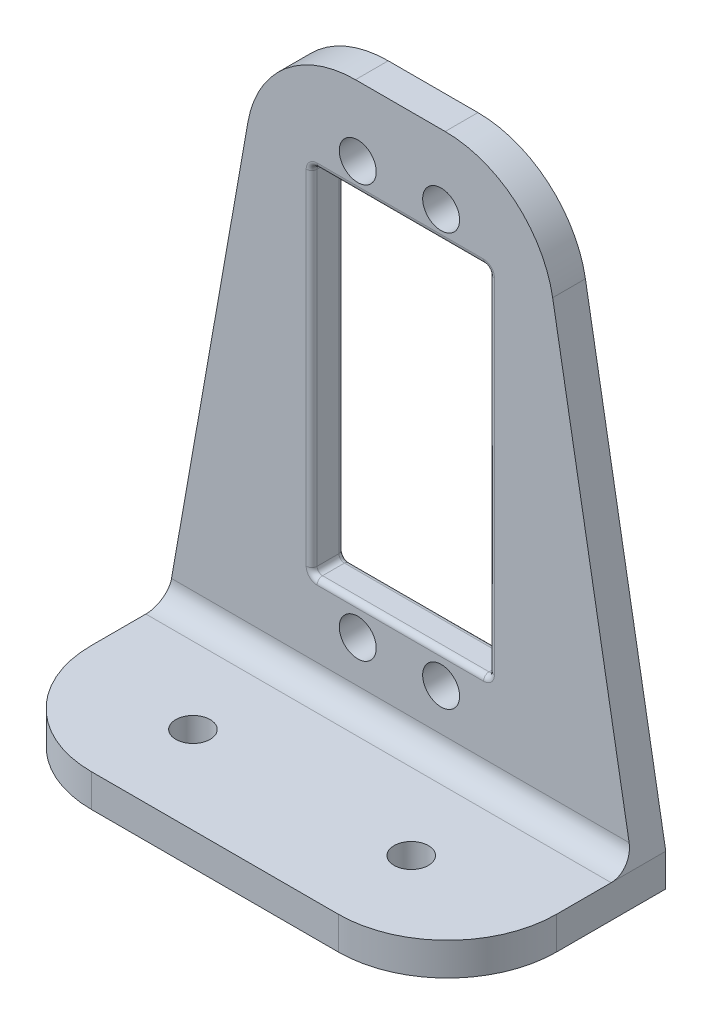
from build123d import *

# Parameters (mm, degrees)
FILLET2_START       = -0.929916211
FILLET2_OUTLINE_R   = 2.15
FILLET2_DEPTH       = 3.81
FILLET2_START_2     = 2.880083789
FILLET2_2_OUTLINE_W = 54.14352655
FILLET2_2_OUTLINE_H = 3.81
FILLET2_2_DEPTH     = 34.29
FILLET6_R           = 2.54
SKETCH6_W           = 54.14352655
SKETCH6_H           = 3.81
CUT_EXTRUDE2_DEPTH  = 12.7
FILLET8_R           = 12.7
SKETCH7_R           = 1.999996
CUT_EXTRUDE3_DEPTH  = 76.817206459
SKETCH8_W           = 20.6375
SKETCH8_H           = 41.275
CUT_EXTRUDE5_DEPTH  = 69.202637613
FILLET10_R          = 0.635


with BuildPart() as part:
    # Fillet2: read off the stored shape, not the designer's step
    # Fillet2 outline → Fillet2 (new body)
    with BuildSketch(Plane.XY.offset(FILLET2_START)):
        with BuildLine():
            Line((20.718778313, -51.581857548), (11.372508186, 1.423474309))
            ThreePointArc((11.372508186, 1.423474309), (7.028852365, 8.94690688), (-1.134550278, 11.918142452))
            Line((-1.134550278, 11.918142452), (-11.571419646, 11.918142452))
            ThreePointArc((-11.571419646, 11.918142452), (-19.734822289, 8.94690688), (-24.078478109, 1.423474309))
            Line((-24.078478109, 1.423474309), (-33.424748237, -51.581857548))
            Line((-33.424748237, -51.581857548), (-33.424748237, -55.391857548))
            Line((-33.424748237, -55.391857548), (20.718778313, -55.391857548))
            Line((20.718778313, -55.391857548), (20.718778313, -51.581857548))
        make_face()
        with Locations((-11.306344138, -44.161858203)):
            Circle(FILLET2_OUTLINE_R, mode=Mode.SUBTRACT)
        with Locations((-1.606344138, -44.161858203)):
            Circle(FILLET2_OUTLINE_R, mode=Mode.SUBTRACT)
        with Locations((-11.306344138, 3.838143108)):
            Circle(FILLET2_OUTLINE_R, mode=Mode.SUBTRACT)
        with Locations((-1.606344138, 3.838143108)):
            Circle(FILLET2_OUTLINE_R, mode=Mode.SUBTRACT)
    extrude(amount=FILLET2_DEPTH)

    # Fillet2 2 outline → Fillet2 2 (add)
    with BuildSketch(Plane.XY.offset(FILLET2_START_2)):
        with Locations((-6.352984962, -53.486857548)):
            Rectangle(FILLET2_2_OUTLINE_W, FILLET2_2_OUTLINE_H)
    extrude(amount=FILLET2_2_DEPTH)

    # Fillet6
    fillet6_edges = [part.edges().sort_by_distance(p)[0] for p in [
        (-6.352984962, -51.581857548, 2.880083789),
    ]]
    fillet(fillet6_edges, radius=FILLET6_R)

    # Sketch6 → Cut-Extrude2 (cut)
    with BuildSketch(Plane.XY.offset(37.170083789)):
        with Locations((-6.352984962, -53.486857548)):
            Rectangle(SKETCH6_W, SKETCH6_H)
    extrude(amount=-CUT_EXTRUDE2_DEPTH, mode=Mode.SUBTRACT)

    # Fillet8
    fillet8_edges = [part.edges().sort_by_distance(p)[0] for p in [
        (-33.424748237, -53.486857548, 24.470083789),
        (20.718778313, -53.486857548, 24.470083789),
    ]]
    fillet(fillet8_edges, radius=FILLET8_R)

    # Sketch7 → Cut-Extrude3 (cut, through all)
    with BuildSketch(Plane(origin=(0, -51.581857548, 0), x_dir=(1, 0, 0), z_dir=(0, 1, 0))):
        with Locations(Location((-19.052984962, -14.310083789, 0), (0, 0, 270))):
            Circle(SKETCH7_R)
        with Locations(Location((6.347015038, -14.310083789, 0), (0, 0, 90))):
            Circle(SKETCH7_R)
    extrude(amount=-CUT_EXTRUDE3_DEPTH, mode=Mode.SUBTRACT)

    # Sketch8 → Cut-Extrude5 (cut, through all)
    with BuildSketch(Plane.XY.offset(2.880083789)):
        with Locations((-6.352984962, -19.974356892)):
            Rectangle(SKETCH8_W, SKETCH8_H)
    extrude(amount=-CUT_EXTRUDE5_DEPTH, mode=Mode.SUBTRACT)

    # Fillet10
    fillet10_edges = [part.edges().sort_by_distance(p)[0] for p in [
        (3.965765038, -19.974356892, 2.880083789),
        (3.965765038, 0.663143108, 0.975083789),
        (-6.352984962, -40.611856892, -0.929916211),
        (3.965765038, -40.611856892, 0.975083789),
        (-16.671734962, -19.974356892, -0.929916211),
        (-16.671734962, -40.611856892, 0.975083789),
        (-6.352984962, 0.663143108, 2.880083789),
        (-16.671734962, 0.663143108, 0.975083789),
        (3.965765038, -19.974356892, -0.929916211),
        (-6.352984962, 0.663143108, -0.929916211),
        (-16.671734962, -19.974356892, 2.880083789),
        (-6.352984962, -40.611856892, 2.880083789),
    ]]
    fillet(fillet10_edges, radius=FILLET10_R)


solid = part.part
